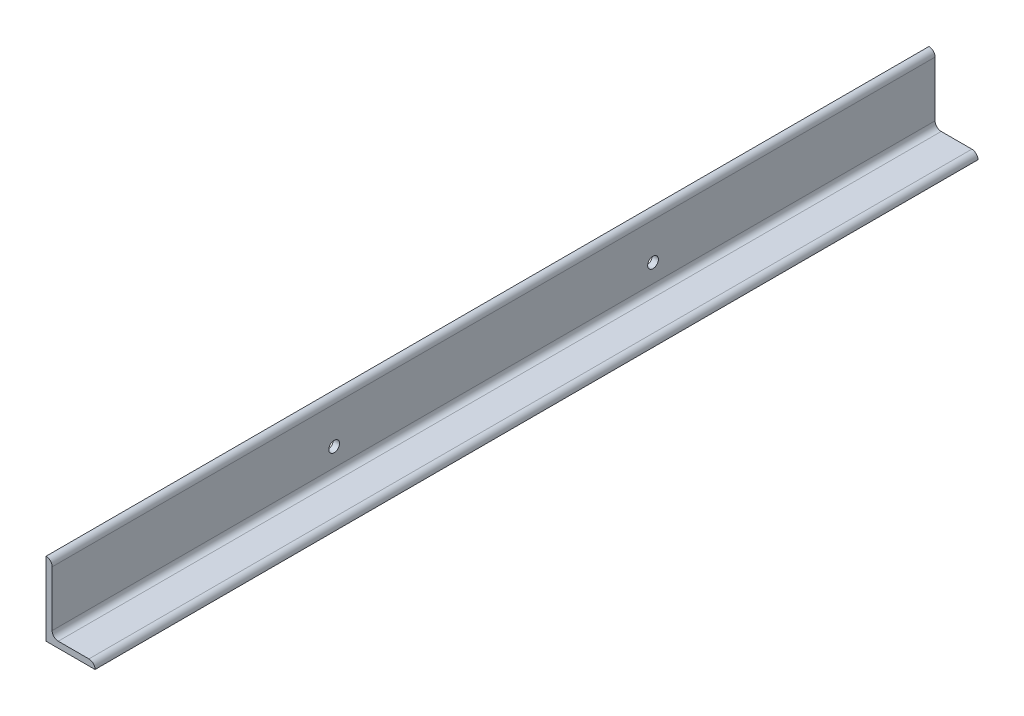
from build123d import *

# Parameters (mm, degrees)
BOSS_EXTRUDE1_DEPTH = 914.4
CUT_EXTRUDE1_REACH  = 934.564
SKETCH2_R           = 11.1125


with BuildPart() as part:
    # Sketch1 → Boss-Extrude1 (new, symmetric)
    with BuildSketch(Plane.XY):
        with BuildLine():
            Line((0, 0), (0, 152.4))
            Line((0, 152.4), (0.00508, 152.4))
            ThreePointArc((0.00508, 152.4), (8.981744019, 148.681744019), (12.7, 139.70508))
            Line((12.7, 139.70508), (12.7, 25.4))
            ThreePointArc((12.7, 25.4), (16.419743879, 16.419743879), (25.4, 12.7))
            Line((25.4, 12.7), (88.90508, 12.7))
            ThreePointArc((88.90508, 12.7), (97.881744019, 8.981744019), (101.6, 0.00508))
            Line((101.6, 0.00508), (101.6, 0))
            Line((101.6, 0), (0, 0))
        make_face()
    extrude(amount=BOSS_EXTRUDE1_DEPTH, both=True)

    # Sketch2 → Cut-Extrude1 (cut, up to next)
    with BuildSketch(Plane.ZY, mode=Mode.PRIVATE) as cut_extrude1_sk1:
        with Locations((330.2, 63.5)):
            Circle(SKETCH2_R)
    cut_extrude1_tool1 = extrude(cut_extrude1_sk1.sketch, amount=-CUT_EXTRUDE1_REACH, mode=Mode.PRIVATE) & part.part
    # Sketch2 → Cut-Extrude1 (cut, up to next)
    with BuildSketch(Plane.ZY, mode=Mode.PRIVATE) as cut_extrude1_sk2:
        with Locations((-330.2, 63.5)):
            Circle(SKETCH2_R)
    cut_extrude1_tool2 = extrude(cut_extrude1_sk2.sketch, amount=-CUT_EXTRUDE1_REACH, mode=Mode.PRIVATE) & part.part
    add(cut_extrude1_tool1.solids().sort_by_distance((0, 63.5, 330.2))[0], mode=Mode.SUBTRACT)
    add(cut_extrude1_tool2.solids().sort_by_distance((0, 63.5, -330.2))[0], mode=Mode.SUBTRACT)


solid = part.part
